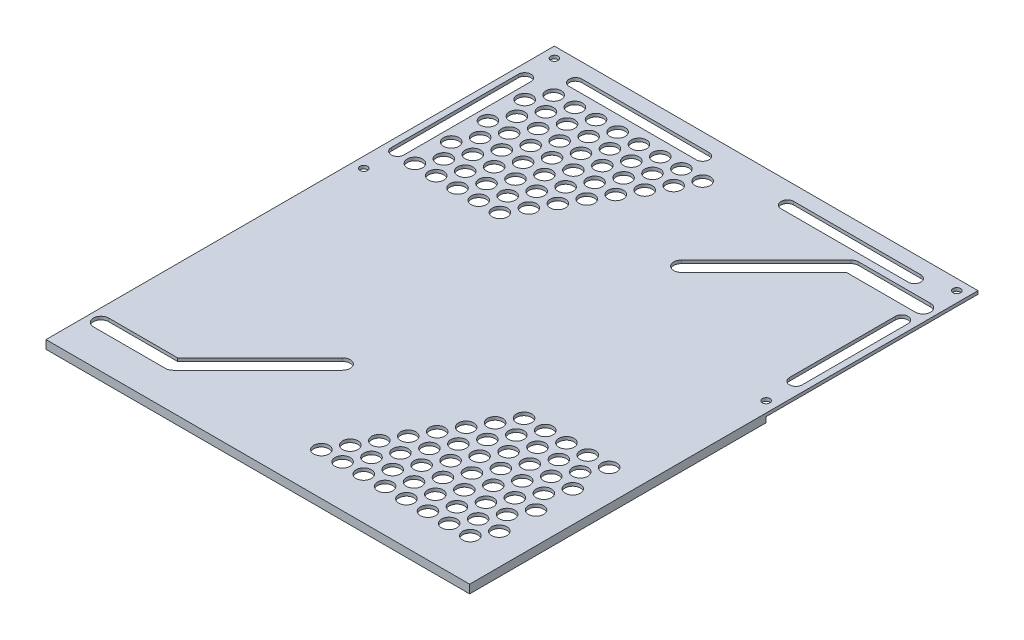
from build123d import *

# Parameters (mm, degrees)
SKETCH1_W               = 127
SKETCH1_H               = 152.4
BOSS_EXTRUDE1_DEPTH     = 2.54
SKETCH5_W               = 127
SKETCH5_H               = 63.5
CUT_EXTRUDE2_DEPTH      = 1.5875
CUT_EXTRUDE5_DEPTH      = 199.396601785
SKETCH10_R              = 2.286
CUT_EXTRUDE6_DEPTH      = 199.396601785
CUT_EXTRUDE7_DEPTH      = 199.396601785
CUT_EXTRUDE7_DEPTH_BACK = 199.396601785
CUT_EXTRUDE8_DEPTH      = 1.5875
CUT_EXTRUDE9_DEPTH      = 1.5875
SKETCH15_R              = 1.1303
CUT_EXTRUDE10_DEPTH     = 199.396601785
CUT_EXTRUDE11_DEPTH     = 199.396601785


with BuildPart() as part:
    # Sketch1 → Boss-Extrude1 (new body)
    with BuildSketch(Plane(origin=(0, 0, 0), x_dir=(1, 0, 0), z_dir=(0, 1, 0))):
        with Locations((63.5, 76.2)):
            Rectangle(SKETCH1_W, SKETCH1_H)
    extrude(amount=BOSS_EXTRUDE1_DEPTH)

    # Sketch5 → Cut-Extrude2 (cut)
    with BuildSketch(Plane(origin=(0, 0, 0), x_dir=(1, 0, 0), z_dir=(0, 1, 0))):
        with Locations((63.5, 120.65)):
            Rectangle(SKETCH5_W, SKETCH5_H)
    extrude(amount=CUT_EXTRUDE2_DEPTH, mode=Mode.SUBTRACT)

    # Sketch9 → Cut-Extrude5 (cut, through all)
    with BuildSketch(Plane(origin=(0, 2.54, 0), x_dir=(1, 0, 0), z_dir=(0, 1, 0))):
        with BuildLine():
            Line((27.016446102, 11.083553898), (52.416446102, 36.483553898))
            ThreePointArc((52.416446102, 36.483553898), (52.416446102, 39.716446102), (49.183553898, 39.716446102))
            Line((49.183553898, 39.716446102), (24.453107796, 14.986))
            Line((24.453107796, 14.986), (3.81, 14.986))
            ThreePointArc((3.81, 14.986), (1.524, 12.7), (3.81, 10.414))
            Line((3.81, 10.414), (25.4, 10.414))
            ThreePointArc((25.4, 10.414), (26.274814326, 10.588011389), (27.016446102, 11.083553898))
        make_face()
        with BuildLine():
            Line((99.983553898, 141.316446102), (74.583553898, 115.916446102))
            ThreePointArc((74.583553898, 115.916446102), (74.583553898, 112.683553898), (77.816446102, 112.683553898))
            Line((77.816446102, 112.683553898), (102.546892204, 137.414))
            Line((102.546892204, 137.414), (123.19, 137.414))
            ThreePointArc((123.19, 137.414), (125.476, 139.7), (123.19, 141.986))
            Line((123.19, 141.986), (101.6, 141.986))
            ThreePointArc((101.6, 141.986), (100.725185674, 141.811988611), (99.983553898, 141.316446102))
        make_face()
    extrude(amount=-CUT_EXTRUDE5_DEPTH, mode=Mode.SUBTRACT)

    # Sketch10 → Cut-Extrude6 (cut, through all)
    with BuildSketch(Plane(origin=(0, 2.54, 0), x_dir=(1, 0, 0), z_dir=(0, 1, 0))):
        with Locations((82.55, 12.7)):
            Circle(SKETCH10_R)
        with Locations((85.727674349, 18.203893422)):
            Circle(SKETCH10_R)
        with Locations((88.905348698, 23.707786845)):
            Circle(SKETCH10_R)
        with Locations((92.083023047, 29.211680267)):
            Circle(SKETCH10_R)
        with Locations((95.260697396, 34.71557369)):
            Circle(SKETCH10_R)
        with Locations((98.438371745, 40.219467112)):
            Circle(SKETCH10_R)
        with Locations((101.616046094, 45.723360535)):
            Circle(SKETCH10_R)
        with Locations((104.793720443, 51.227253957)):
            Circle(SKETCH10_R)
        with Locations((92.124458299, 18.203893422)):
            Circle(SKETCH10_R)
        with Locations((95.302132648, 23.707786845)):
            Circle(SKETCH10_R)
        with Locations((98.479806997, 29.211680267)):
            Circle(SKETCH10_R)
        with Locations((101.657481346, 34.71557369)):
            Circle(SKETCH10_R)
        with Locations((104.835155695, 40.219467112)):
            Circle(SKETCH10_R)
        with Locations((108.012830044, 45.723360535)):
            Circle(SKETCH10_R)
        with Locations((111.190504393, 51.227253957)):
            Circle(SKETCH10_R)
        with Locations((88.94678395, 12.7)):
            Circle(SKETCH10_R)
        with Locations((98.521242248, 18.203893422)):
            Circle(SKETCH10_R)
        with Locations((101.698916597, 23.707786845)):
            Circle(SKETCH10_R)
        with Locations((104.876590946, 29.211680267)):
            Circle(SKETCH10_R)
        with Locations((108.054265295, 34.71557369)):
            Circle(SKETCH10_R)
        with Locations((111.231939644, 40.219467112)):
            Circle(SKETCH10_R)
        with Locations((114.409613993, 45.723360535)):
            Circle(SKETCH10_R)
        with Locations((117.587288342, 51.227253957)):
            Circle(SKETCH10_R)
        with Locations((95.343567899, 12.7)):
            Circle(SKETCH10_R)
        with Locations((101.810527773, 12.7)):
            Circle(SKETCH10_R)
        with Locations((104.988202122, 18.203893422)):
            Circle(SKETCH10_R)
        with Locations((108.165876471, 23.707786845)):
            Circle(SKETCH10_R)
        with Locations((111.34355082, 29.211680267)):
            Circle(SKETCH10_R)
        with Locations((114.521225169, 34.71557369)):
            Circle(SKETCH10_R)
        with Locations((117.698899518, 40.219467112)):
            Circle(SKETCH10_R)
        with Locations((108.160527773, 12.7)):
            Circle(SKETCH10_R)
        with Locations((111.338202122, 18.203893422)):
            Circle(SKETCH10_R)
        with Locations((114.515876471, 23.707786845)):
            Circle(SKETCH10_R)
        with Locations((117.69355082, 29.211680267)):
            Circle(SKETCH10_R)
        with Locations((114.510527773, 12.7)):
            Circle(SKETCH10_R)
        with Locations((117.688202122, 18.203893422)):
            Circle(SKETCH10_R)
        with Locations((44.58196276, 139.566077757)):
            Circle(SKETCH10_R)
        with Locations((41.404288411, 134.062184334)):
            Circle(SKETCH10_R)
        with Locations((38.226614062, 128.558290912)):
            Circle(SKETCH10_R)
        with Locations((35.048939713, 123.054397489)):
            Circle(SKETCH10_R)
        with Locations((31.871265364, 117.550504067)):
            Circle(SKETCH10_R)
        with Locations((28.693591015, 112.046610644)):
            Circle(SKETCH10_R)
        with Locations((25.515916666, 106.542717222)):
            Circle(SKETCH10_R)
        with Locations((22.338242317, 101.038823799)):
            Circle(SKETCH10_R)
        with Locations((35.007504462, 134.062184334)):
            Circle(SKETCH10_R)
        with Locations((31.829830113, 128.558290912)):
            Circle(SKETCH10_R)
        with Locations((28.652155764, 123.054397489)):
            Circle(SKETCH10_R)
        with Locations((25.474481415, 117.550504067)):
            Circle(SKETCH10_R)
        with Locations((22.296807066, 112.046610644)):
            Circle(SKETCH10_R)
        with Locations((19.119132717, 106.542717222)):
            Circle(SKETCH10_R)
        with Locations((15.941458367, 101.038823799)):
            Circle(SKETCH10_R)
        with Locations((38.185178811, 139.566077757)):
            Circle(SKETCH10_R)
        with Locations((28.610720512, 134.062184334)):
            Circle(SKETCH10_R)
        with Locations((25.433046163, 128.558290912)):
            Circle(SKETCH10_R)
        with Locations((22.255371814, 123.054397489)):
            Circle(SKETCH10_R)
        with Locations((19.077697465, 117.550504067)):
            Circle(SKETCH10_R)
        with Locations((15.900023116, 112.046610644)):
            Circle(SKETCH10_R)
        with Locations((12.722348767, 106.542717222)):
            Circle(SKETCH10_R)
        with Locations((9.544674418, 101.038823799)):
            Circle(SKETCH10_R)
        with Locations((31.788394861, 139.566077757)):
            Circle(SKETCH10_R)
        with Locations((25.321434988, 139.566077757)):
            Circle(SKETCH10_R)
        with Locations((22.143760639, 134.062184334)):
            Circle(SKETCH10_R)
        with Locations((18.966086289, 128.558290912)):
            Circle(SKETCH10_R)
        with Locations((15.78841194, 123.054397489)):
            Circle(SKETCH10_R)
        with Locations((12.610737591, 117.550504067)):
            Circle(SKETCH10_R)
        with Locations((9.433063242, 112.046610644)):
            Circle(SKETCH10_R)
        with Locations((18.971434988, 139.566077757)):
            Circle(SKETCH10_R)
        with Locations((15.793760639, 134.062184334)):
            Circle(SKETCH10_R)
        with Locations((12.616086289, 128.558290912)):
            Circle(SKETCH10_R)
        with Locations((9.43841194, 123.054397489)):
            Circle(SKETCH10_R)
        with Locations((12.621434988, 139.566077757)):
            Circle(SKETCH10_R)
        with Locations((9.443760639, 134.062184334)):
            Circle(SKETCH10_R)
        with Locations((76.2, 12.7)):
            Circle(SKETCH10_R)
        with Locations((79.377674349, 18.203893422)):
            Circle(SKETCH10_R)
        with Locations((82.555348698, 23.707786845)):
            Circle(SKETCH10_R)
        with Locations((85.733023047, 29.211680267)):
            Circle(SKETCH10_R)
        with Locations((88.910697396, 34.71557369)):
            Circle(SKETCH10_R)
        with Locations((92.088371745, 40.219467112)):
            Circle(SKETCH10_R)
        with Locations((95.266046094, 45.723360535)):
            Circle(SKETCH10_R)
        with Locations((98.443720443, 51.227253957)):
            Circle(SKETCH10_R)
        with Locations((69.85, 12.7)):
            Circle(SKETCH10_R)
        with Locations((73.027674349, 18.203893422)):
            Circle(SKETCH10_R)
        with Locations((76.205348698, 23.707786845)):
            Circle(SKETCH10_R)
        with Locations((79.383023047, 29.211680267)):
            Circle(SKETCH10_R)
        with Locations((82.560697396, 34.71557369)):
            Circle(SKETCH10_R)
        with Locations((85.738371745, 40.219467112)):
            Circle(SKETCH10_R)
        with Locations((88.916046094, 45.723360535)):
            Circle(SKETCH10_R)
        with Locations((92.093720443, 51.227253957)):
            Circle(SKETCH10_R)
        with Locations((28.688242317, 101.038823799)):
            Circle(SKETCH10_R)
        with Locations((31.865916666, 106.542717222)):
            Circle(SKETCH10_R)
        with Locations((35.043591015, 112.046610644)):
            Circle(SKETCH10_R)
        with Locations((38.221265364, 117.550504067)):
            Circle(SKETCH10_R)
        with Locations((41.398939713, 123.054397489)):
            Circle(SKETCH10_R)
        with Locations((44.576614062, 128.558290912)):
            Circle(SKETCH10_R)
        with Locations((47.754288411, 134.062184334)):
            Circle(SKETCH10_R)
        with Locations((50.93196276, 139.566077757)):
            Circle(SKETCH10_R)
        with Locations((35.038242317, 101.038823799)):
            Circle(SKETCH10_R)
        with Locations((38.215916666, 106.542717222)):
            Circle(SKETCH10_R)
        with Locations((41.393591015, 112.046610644)):
            Circle(SKETCH10_R)
        with Locations((44.571265364, 117.550504067)):
            Circle(SKETCH10_R)
        with Locations((47.748939713, 123.054397489)):
            Circle(SKETCH10_R)
        with Locations((50.926614062, 128.558290912)):
            Circle(SKETCH10_R)
        with Locations((54.104288411, 134.062184334)):
            Circle(SKETCH10_R)
        with Locations((57.28196276, 139.566077757)):
            Circle(SKETCH10_R)
    extrude(amount=-CUT_EXTRUDE6_DEPTH, mode=Mode.SUBTRACT)

    # Sketch12 → Cut-Extrude7 (cut, two sides: drawn at the far end of the back side and taken through both)
    with BuildSketch(Plane(origin=(0, 2.54, 0), x_dir=(1, 0, 0), z_dir=(0, 1, 0)).offset(-CUT_EXTRUDE7_DEPTH_BACK)):
        with BuildLine():
            Line((76.2, 147.955), (114.3, 147.955))
            ThreePointArc((114.3, 147.955), (116.205, 146.05), (114.3, 144.145))
            Line((114.3, 144.145), (76.2, 144.145))
            ThreePointArc((76.2, 144.145), (74.295, 146.05), (76.2, 147.955))
        make_face()
        with BuildLine():
            Line((50.8, 147.955), (12.7, 147.955))
            ThreePointArc((12.7, 147.955), (10.795, 146.05), (12.7, 144.145))
            Line((12.7, 144.145), (50.8, 144.145))
            ThreePointArc((50.8, 144.145), (52.705, 146.05), (50.8, 147.955))
        make_face()
        with BuildLine():
            Line((5.715, 139.7), (5.715, 101.6))
            ThreePointArc((5.715, 101.6), (3.81, 99.695), (1.905, 101.6))
            Line((1.905, 101.6), (1.905, 139.7))
            ThreePointArc((1.905, 139.7), (3.81, 141.605), (5.715, 139.7))
        make_face()
    extrude(amount=CUT_EXTRUDE7_DEPTH + CUT_EXTRUDE7_DEPTH_BACK, mode=Mode.SUBTRACT)

    # Sketch13 → Cut-Extrude8 (cut)
    with BuildSketch(Plane.XZ):
        with BuildLine():
            Line((23.427307909, -17.4625), (47.432403955, -41.467596045))
            ThreePointArc((47.432403955, -41.467596045), (54.167596045, -41.467596045), (54.167596045, -34.732403955))
            Line((54.167596045, -34.732403955), (28.767596045, -9.332403955))
            ThreePointArc((28.767596045, -9.332403955), (27.222529847, -8.300023726), (25.4, -7.9375))
            Line((25.4, -7.9375), (3.81, -7.9375))
            ThreePointArc((3.81, -7.9375), (-0.9525, -12.7), (3.81, -17.4625))
            Line((3.81, -17.4625), (23.427307909, -17.4625))
        make_face()
    extrude(amount=-CUT_EXTRUDE8_DEPTH, mode=Mode.SUBTRACT)

    # Sketch14 → Cut-Extrude9 (cut)
    with BuildSketch(Plane.XZ):
        with BuildLine():
            Line((65.725554014, -15.08125), (87.969274458, -53.608503957))
            ThreePointArc((87.969274458, -53.608503957), (89.712470443, -55.351699943), (92.093720443, -55.989753957))
            Line((92.093720443, -55.989753957), (117.587288342, -55.989753957))
            ThreePointArc((117.587288342, -55.989753957), (120.949735074, -54.599991455), (122.349766106, -51.24180728))
            Line((122.349766106, -51.24180728), (122.450679886, -18.218446745))
            ThreePointArc((122.450679886, -18.218446745), (122.209317916, -16.70692374), (121.500931037, -15.3500356))
            Line((121.500931037, -15.3500356), (118.683035071, -10.404005859))
            ThreePointArc((118.683035071, -10.404005859), (116.934030832, -8.600239132), (114.510527773, -7.9375))
            Line((114.510527773, -7.9375), (69.85, -7.9375))
            ThreePointArc((69.85, -7.9375), (65.725554014, -10.31875), (65.725554014, -15.08125))
        make_face()
    extrude(amount=-CUT_EXTRUDE9_DEPTH, mode=Mode.SUBTRACT)

    # Sketch15 → Cut-Extrude10 (cut, through all)
    with BuildSketch(Plane(origin=(0, 2.54, 0), x_dir=(1, 0, 0), z_dir=(0, 1, 0))):
        with Locations((3.175, 149.225)):
            Circle(SKETCH15_R)
        with Locations((3.175, 92.075)):
            Circle(SKETCH15_R)
        with Locations((123.825, 92.075)):
            Circle(SKETCH15_R)
        with Locations((123.825, 149.225)):
            Circle(SKETCH15_R)
    extrude(amount=-CUT_EXTRUDE10_DEPTH, mode=Mode.SUBTRACT)

    # Sketch16 → Cut-Extrude11 (cut, through all)
    with BuildSketch(Plane(origin=(0, 2.54, 0), x_dir=(1, 0, 0), z_dir=(0, 1, 0))):
        with BuildLine():
            Line((121.285, 101.6), (121.285, 133.35))
            ThreePointArc((121.285, 133.35), (123.19, 135.255), (125.095, 133.35))
            Line((125.095, 133.35), (125.095, 101.6))
            ThreePointArc((125.095, 101.6), (123.19, 99.695), (121.285, 101.6))
        make_face()
    extrude(amount=-CUT_EXTRUDE11_DEPTH, mode=Mode.SUBTRACT)


solid = part.part
